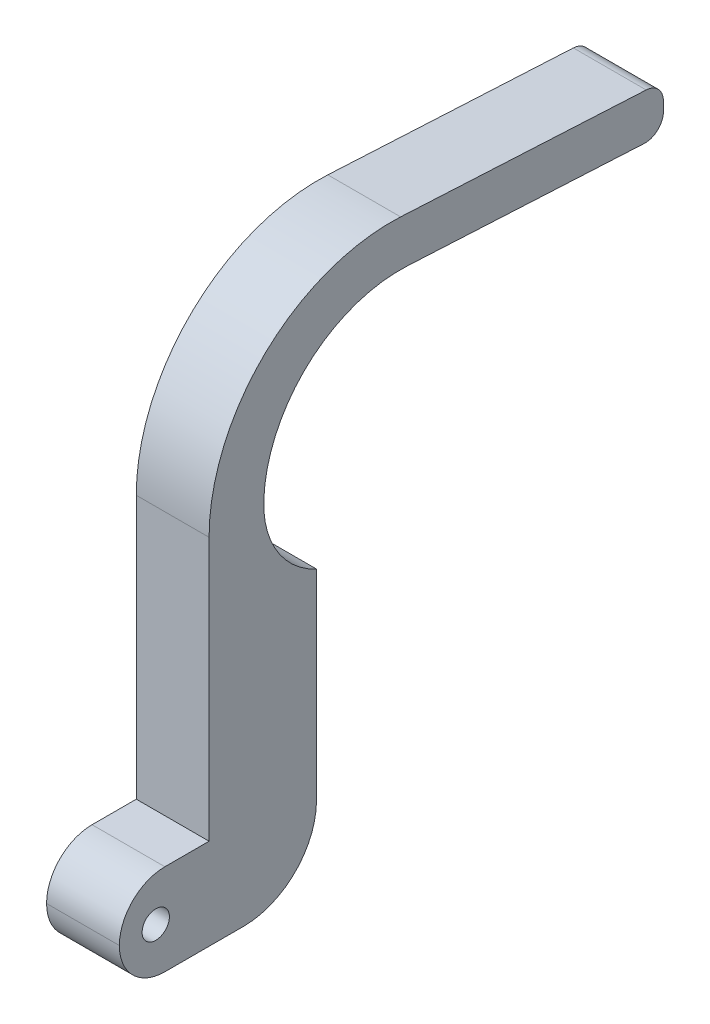
from build123d import *

# Parameters (mm, degrees)
BOSS_EXTRUDE2_DEPTH = 8
FILLET1_R           = 15
FILLET2_R           = 20
FILLET3_R           = 10
FILLET4_R           = 2
FILLET5_R           = 5
SKETCH3_R           = 1.5
CUT_EXTRUDE1_DEPTH  = 78.668634045
FILLET6_R           = 8


# Some blends are built 0.0001 mm under size
with BuildPart() as part:
    # Sketch2 → Boss-Extrude2 (new body)
    with BuildSketch(Plane(origin=(0, 0, 0), x_dir=(0, 0, -1), z_dir=(1, 0, 0))):
        Polygon((0, 0), (9.858322093, 0), (9.858322093, 50), (59.789798831, 47.383202188), (59.789798831, 42.383202188), (15.858322093, 44.685553324), (15.858322093, 20), (21.66602455, 20), (21.66602455, -10), (0, -10), align=None)
    extrude(amount=BOSS_EXTRUDE2_DEPTH)

    # Fillet1
    fillet1_edges = [part.edges().sort_by_distance(p)[0] for p in [
        (4, 44.685553324, -15.858322093),
    ]]
    fillet(fillet1_edges, radius=FILLET1_R)

    # Fillet2
    fillet2_edges = [part.edges().sort_by_distance(p)[0] for p in [
        (4, 50, -9.858322093),
    ]]
    fillet(fillet2_edges, radius=FILLET2_R)

    # Fillet3
    # the kernel refuses this fillet: 10 mm, written as the material it adds along each edge
    with BuildSketch(Plane(origin=(0, 20, -15.858322093), x_dir=(0, 0.9999992265968354, -0.0012437064489906054), z_dir=(1, 0, 0))) as fillet3_piece_1:
        with BuildLine():
            CenterArc((9.089422143, -9.992630476), FILLET3_R, 87.800195831, 67.460307547)
            Line((0.007223077, -5.807697966), (-0.90099683, -5.389204715))
            ThreePointArc((-0.90099683, -5.389204715), (-0.996387688, -2.905092689), (-0.999999227, -0.001243706))
            Line((-0.999999227, -0.001243706), (-0.001243706, 0.999999227))
            ThreePointArc((-0.001243706, 0.999999227), (8.877600872, 1.011041911), (9.511650474, 0.999263048))
            Line((9.511650474, 0.999263048), (9.473266081, 0))
        make_face()
    extrude(amount=8)

    # Fillet4
    fillet4_edges = [part.edges().sort_by_distance(p)[0] for p in [
        (4, 47.383202188, -59.789798831),
        (4, 42.383202188, -59.789798831),
    ]]
    fillet(fillet4_edges, radius=FILLET4_R)

    # Fillet5
    fillet5_edges = [part.edges().sort_by_distance(p)[0] for p in [
        (4, -10, 0),
        (4, 0, 0),
    ]]
    fillet(fillet5_edges, radius=FILLET5_R - 0.0001)  # a hair under: the kernel refuses the full size

    # Sketch3 → Cut-Extrude1 (cut, through all)
    with BuildSketch(Plane(origin=(8, 0, 0), x_dir=(0, 0, -1), z_dir=(1, 0, 0))):
        with Locations((4, -5)):
            Circle(SKETCH3_R)
    extrude(amount=-CUT_EXTRUDE1_DEPTH, mode=Mode.SUBTRACT)

    # Fillet6
    fillet6_edges = [part.edges().sort_by_distance(p)[0] for p in [
        (4, -10, -21.66602455),
    ]]
    fillet(fillet6_edges, radius=FILLET6_R)


solid = part.part
